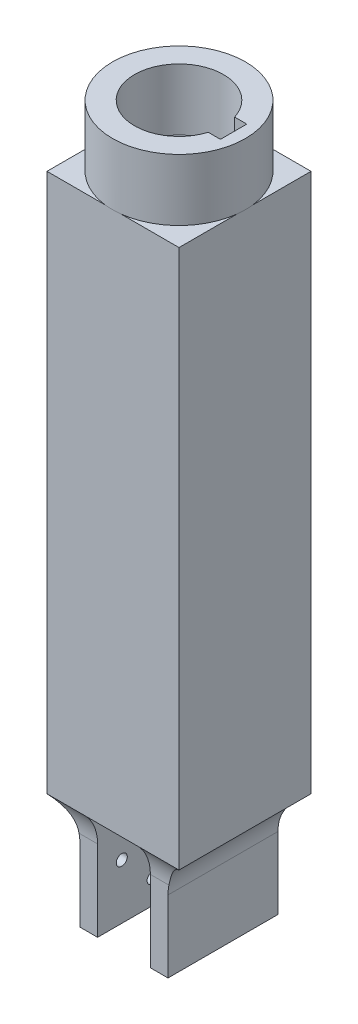
from build123d import *

# Parameters (mm, degrees)
SKETCH1_W           = 30
SKETCH1_H           = 30
BOSS_EXTRUDE1_DEPTH = 122.5
SKETCH2_W           = 4
SKETCH2_H           = 25
BOSS_EXTRUDE2_DEPTH = 25
SKETCH3_W           = 24
SKETCH3_H           = 24
CUT_EXTRUDE1_DEPTH  = 110
SKETCH5_W           = 24
SKETCH5_H           = 24
BOSS_EXTRUDE4_DEPTH = 4
SKETCH4_R           = 15.1
BOSS_EXTRUDE3_DEPTH = 14
SKETCH7_W           = 2.767549144
SKETCH7_H           = 5.993795478
CUT_EXTRUDE3_DEPTH  = 4
SKETCH12_R          = 2.1
CUT_EXTRUDE6_DEPTH  = 150.037813994
SKETCH13_W          = 9
SKETCH13_H          = 22
CUT_EXTRUDE7_DEPTH  = 20
SKETCH8_R           = 1.25
SKETCH8_R_2         = 1.5
CUT_EXTRUDE4_DEPTH  = 4
FILLET1_R           = 10


with BuildPart() as part:
    # Sketch1 → Boss-Extrude1 (new body)
    with BuildSketch(Plane(origin=(0, 0, 0), x_dir=(1, 0, 0), z_dir=(0, 1, 0))):
        Rectangle(SKETCH1_W, SKETCH1_H)
    extrude(amount=BOSS_EXTRUDE1_DEPTH)

    # Sketch2 → Boss-Extrude2 (add)
    with BuildSketch(Plane.XZ):
        with Locations((-8, 0)):
            Rectangle(SKETCH2_W, SKETCH2_H)
        with Locations((8, 0)):
            Rectangle(SKETCH2_W, SKETCH2_H)
    extrude(amount=BOSS_EXTRUDE2_DEPTH)

    # Sketch3 → Cut-Extrude1 (cut)
    with BuildSketch(Plane(origin=(0, 122.5, 0), x_dir=(1, 0, 0), z_dir=(0, 1, 0))):
        Rectangle(SKETCH3_W, SKETCH3_H)
    extrude(amount=-CUT_EXTRUDE1_DEPTH, mode=Mode.SUBTRACT)

    # Sketch5 → Boss-Extrude4 (add)
    with BuildSketch(Plane(origin=(0, 122.5, 0), x_dir=(1, 0, 0), z_dir=(0, 1, 0))):
        Rectangle(SKETCH5_W, SKETCH5_H)
    extrude(amount=-BOSS_EXTRUDE4_DEPTH)

    # Sketch4 → Boss-Extrude3 (add)
    with BuildSketch(Plane(origin=(0, 122.5, 0), x_dir=(1, 0, 0), z_dir=(0, 1, 0))):
        with Locations(Location((0, 0, 0), (0, 0, 83.402352246))):
            Circle(SKETCH4_R)
        with BuildLine():
            Line((12.412682836, -2.996897739), (12.412682836, 2.996897739))
            Line((12.412682836, 2.996897739), (9.645133692, 2.996897739))
            ThreePointArc((9.645133692, 2.996897739), (-10.1, 0), (9.645133692, -2.996897739))
            Line((9.645133692, -2.996897739), (12.412682836, -2.996897739))
        make_face(mode=Mode.SUBTRACT)
    extrude(amount=BOSS_EXTRUDE3_DEPTH)

    # Sketch7 → Cut-Extrude3 (cut)
    with BuildSketch(Plane(origin=(0, 122.5, 0), x_dir=(1, 0, 0), z_dir=(0, 1, 0))):
        with Locations((11.028908264, 0)):
            Rectangle(SKETCH7_W, SKETCH7_H)
    extrude(amount=-CUT_EXTRUDE3_DEPTH, mode=Mode.SUBTRACT)

    # Sketch12 → Cut-Extrude6 (cut, through all)
    with BuildSketch(Plane(origin=(0, 122.5, 0), x_dir=(1, 0, 0), z_dir=(0, 1, 0))):
        with Locations(Location((0, 0, 0), (0, 0, 270))):
            Circle(SKETCH12_R)
    extrude(amount=-CUT_EXTRUDE6_DEPTH, mode=Mode.SUBTRACT)

    # Sketch13 → Cut-Extrude7 (cut)
    with BuildSketch(Plane.XZ):
        Rectangle(SKETCH13_W, SKETCH13_H)
    extrude(amount=-CUT_EXTRUDE7_DEPTH, mode=Mode.SUBTRACT)

    # Sketch8 → Cut-Extrude4 (cut)
    with BuildSketch(Plane.ZY.offset(10)):
        with Locations((0, -5.5)):
            Circle(SKETCH8_R)
        with Locations((7, -12.5)):
            Circle(SKETCH8_R)
        with Locations((0, -19.5)):
            Circle(SKETCH8_R)
        with Locations((-7, -12.5)):
            Circle(SKETCH8_R)
        with Locations((0, -12.5)):
            Circle(SKETCH8_R_2)
    extrude(amount=-CUT_EXTRUDE4_DEPTH, mode=Mode.SUBTRACT)

    # Fillet1
    # the kernel refuses this fillet: 10 mm, written as the material it adds along each edge
    with BuildSketch(Plane(origin=(-10.535945694, 0, -12.5), x_dir=(0, 0, -1), z_dir=(1, 0, 0))) as fillet1_piece_1_section:
        with BuildLine():
            CenterArc((10, -6.614378278), FILLET1_R, 138.590377891, 41.409622109)
            Line((0, -6.614378278), (-0.2, -6.614378278))
            Line((-0.2, -6.614378278), (-0.2, 0))
            Line((-0.2, 0), (0, 0.2))
            ThreePointArc((0, 0.2), (1.25, 0.2), (2.35, 0.132287566))
            Line((2.35, 0.132287566), (2.5, 0))
        make_face()
    fillet1_piece_1 = extrude(amount=20.535945694, mode=Mode.PRIVATE)
    fillet1_piece_1 = split(fillet1_piece_1, bisect_by=Plane(origin=(-10, -1.814075663, -13.097749904), z_dir=(1, 0, 0)), keep=Keep.TOP, mode=Mode.PRIVATE)
    fillet1_piece_1 = split(fillet1_piece_1, bisect_by=Plane(origin=(-6, -1.814075663, -13.097749904), z_dir=(-1, 0, 0)), keep=Keep.TOP, mode=Mode.PRIVATE)
    add(fillet1_piece_1)
    with BuildSketch(Plane(origin=(6, 0, -12.5), x_dir=(0, 0, -1), z_dir=(1, 0, 0)), Plane(origin=(10, 0, 12.5), x_dir=(0, 0, 1), z_dir=(-1, 0, 0))) as fillet1_piece_2:
        with BuildLine():
            CenterArc((10, -6.614378278), FILLET1_R, 138.590377891, 41.409622109)
            Line((0, -6.614378278), (-0.2, -6.614378278))
            Line((-0.2, -6.614378278), (-0.2, 0))
            Line((-0.2, 0), (0, 0.2))
            ThreePointArc((0, 0.2), (1.25, 0.2), (2.35, 0.132287566))
            Line((2.35, 0.132287566), (2.5, 0))
        make_face()
    extrude(amount=4)
    with BuildSketch(Plane(origin=(10, 0, -12.5), x_dir=(1, 0, 0), z_dir=(0, 0, 1))) as fillet1_piece_3:
        with BuildLine():
            CenterArc((10, -8.660254038), FILLET1_R, 120, 60)
            Line((0, -8.660254038), (-0.2, -8.660254038))
            Line((-0.2, -8.660254038), (-0.2, 0))
            Line((-0.2, 0), (0, 0.2))
            ThreePointArc((0, 0.2), (2.5, 0.2), (4.9, 0.173205081))
            Line((4.9, 0.173205081), (5, 0))
        make_face()
    extrude(amount=25)
    with BuildSketch(Plane(origin=(10, 0, 12.5), x_dir=(0, 0, 1), z_dir=(-1, 0, 0))) as fillet1_piece_4_section:
        with BuildLine():
            CenterArc((10, -6.614378278), FILLET1_R, 138.590377891, 41.409622109)
            Line((0, -6.614378278), (-0.2, -6.614378278))
            Line((-0.2, -6.614378278), (-0.2, 0))
            Line((-0.2, 0), (0, 0.2))
            ThreePointArc((0, 0.2), (1.25, 0.2), (2.35, 0.132287566))
            Line((2.35, 0.132287566), (2.5, 0))
        make_face()
    fillet1_piece_4 = extrude(amount=20.535945694, mode=Mode.PRIVATE)
    fillet1_piece_4 = split(fillet1_piece_4, bisect_by=Plane(origin=(-10, -1.814075663, 13.097749904), z_dir=(1, 0, 0)), keep=Keep.TOP, mode=Mode.PRIVATE)
    fillet1_piece_4 = split(fillet1_piece_4, bisect_by=Plane(origin=(-6, -1.814075663, 13.097749904), z_dir=(-1, 0, 0)), keep=Keep.TOP, mode=Mode.PRIVATE)
    add(fillet1_piece_4)
    with BuildSketch(Plane(origin=(-10, 0, 12.5), x_dir=(0, 0, 1), z_dir=(1, 0, 0)), Plane(origin=(-6, 0, -12.5), x_dir=(0, 0, -1), z_dir=(-1, 0, 0))) as fillet1_piece_5:
        with BuildLine():
            CenterArc((10, 6.614378278), FILLET1_R, 180, 41.409622109)
            Line((0, 6.614378278), (-0.2, 6.614378278))
            Line((-0.2, 6.614378278), (-0.2, 0))
            Line((-0.2, 0), (0, -0.2))
            ThreePointArc((0, -0.2), (1.25, -0.2), (2.35, -0.132287566))
            Line((2.35, -0.132287566), (2.5, 0))
        make_face()
    extrude(amount=4)
    with BuildSketch(Plane(origin=(-10, 0, 12.5), x_dir=(0, 0, 1), z_dir=(1, 0, 0))) as fillet1_piece_6_section:
        with BuildLine():
            CenterArc((10, 6.614378278), FILLET1_R, 180, 41.409622109)
            Line((0, 6.614378278), (-0.2, 6.614378278))
            Line((-0.2, 6.614378278), (-0.2, 0))
            Line((-0.2, 0), (0, -0.2))
            ThreePointArc((0, -0.2), (1.25, -0.2), (2.35, -0.132287566))
            Line((2.35, -0.132287566), (2.5, 0))
        make_face()
    fillet1_piece_6 = extrude(amount=20.535945694, mode=Mode.PRIVATE)
    fillet1_piece_6 = split(fillet1_piece_6, bisect_by=Plane(origin=(6, -1.814075663, 13.097749904), z_dir=(1, 0, 0)), keep=Keep.TOP, mode=Mode.PRIVATE)
    fillet1_piece_6 = split(fillet1_piece_6, bisect_by=Plane(origin=(10, -1.814075663, 13.097749904), z_dir=(-1, 0, 0)), keep=Keep.TOP, mode=Mode.PRIVATE)
    add(fillet1_piece_6)
    with BuildSketch(Plane(origin=(-10, 0, -12.5), x_dir=(-1, 0, 0), z_dir=(0, 0, 1))) as fillet1_piece_7_section:
        with BuildLine():
            CenterArc((10, 8.660254038), FILLET1_R, 180, 60)
            Line((0, 8.660254038), (-0.2, 8.660254038))
            Line((-0.2, 8.660254038), (-0.2, 0))
            Line((-0.2, 0), (0, -0.2))
            ThreePointArc((0, -0.2), (2.5, -0.2), (4.9, -0.173205081))
            Line((4.9, -0.173205081), (5, 0))
        make_face()
    fillet1_piece_7 = extrude(amount=25, mode=Mode.PRIVATE)
    fillet1_piece_7 = fillet1_piece_7 - Plane(origin=(-11.30561436, -5.5, 0), x_dir=(0, 0, 1), z_dir=(-1, 0, 0)) * Cylinder(1.25, 85, mode=Mode.PRIVATE)
    add(fillet1_piece_7)
    with BuildSketch(Plane(origin=(10.535945694, 0, -12.5), x_dir=(0, 0, -1), z_dir=(-1, 0, 0))) as fillet1_piece_8_section:
        with BuildLine():
            CenterArc((10, 6.614378278), FILLET1_R, 180, 41.409622109)
            Line((0, 6.614378278), (-0.2, 6.614378278))
            Line((-0.2, 6.614378278), (-0.2, 0))
            Line((-0.2, 0), (0, -0.2))
            ThreePointArc((0, -0.2), (1.25, -0.2), (2.35, -0.132287566))
            Line((2.35, -0.132287566), (2.5, 0))
        make_face()
    fillet1_piece_8 = extrude(amount=20.535945694, mode=Mode.PRIVATE)
    fillet1_piece_8 = split(fillet1_piece_8, bisect_by=Plane(origin=(6, -1.814075663, -13.097749904), z_dir=(1, 0, 0)), keep=Keep.TOP, mode=Mode.PRIVATE)
    fillet1_piece_8 = split(fillet1_piece_8, bisect_by=Plane(origin=(10, -1.814075663, -13.097749904), z_dir=(-1, 0, 0)), keep=Keep.TOP, mode=Mode.PRIVATE)
    add(fillet1_piece_8)
    with BuildSketch(Plane(origin=(6, 0, -12.5), x_dir=(0, 0, -1), z_dir=(1, 0, 0))) as fillet1_piece_9a_section:
        with BuildLine():
            CenterArc((10, -6.614378278), FILLET1_R, 138.590377891, 41.409622109)
            Line((0, -6.614378278), (-0.2, -6.614378278))
            Line((-0.2, -6.614378278), (-0.2, 0))
            Line((-0.2, 0), (0, 0.2))
            ThreePointArc((0, 0.2), (1.25, 0.2), (2.35, 0.132287566))
            Line((2.35, 0.132287566), (2.5, 0))
        make_face()
    fillet1_piece_9a = extrude(amount=20.535945694, mode=Mode.PRIVATE)
    fillet1_piece_9a = split(fillet1_piece_9a, bisect_by=Plane(origin=(15, -1.814075663, -13.097749904), z_dir=(-1, 0, 0)), keep=Keep.TOP, mode=Mode.PRIVATE)
    fillet1_piece_9a = split(fillet1_piece_9a, bisect_by=Plane(origin=(10, -1.814075663, -13.097749904), z_dir=(1, 0, 0)), keep=Keep.TOP, mode=Mode.PRIVATE)
    with BuildSketch(Plane(origin=(10, 0, -34.150635095), x_dir=(1, 0, 0), z_dir=(0, 0, 1))) as fillet1_piece_9b_section:
        with BuildLine():
            CenterArc((10, -8.660254038), FILLET1_R, 120, 60)
            Line((0, -8.660254038), (-0.2, -8.660254038))
            Line((-0.2, -8.660254038), (-0.2, 0))
            Line((-0.2, 0), (0, 0.2))
            ThreePointArc((0, 0.2), (2.5, 0.2), (4.9, 0.173205081))
            Line((4.9, 0.173205081), (5, 0))
        make_face()
    fillet1_piece_9b = extrude(amount=46.650635095, mode=Mode.PRIVATE)
    fillet1_piece_9b = split(fillet1_piece_9b, bisect_by=Plane(origin=(11.295167111, -2.163104458, -15), z_dir=(0, 0, 1)), keep=Keep.TOP, mode=Mode.PRIVATE)
    fillet1_piece_9b = split(fillet1_piece_9b, bisect_by=Plane(origin=(11.295167111, -2.163104458, -12.5), z_dir=(0, 0, -1)), keep=Keep.TOP, mode=Mode.PRIVATE)
    fillet1_piece_9 = fillet1_piece_9a & fillet1_piece_9b
    add(fillet1_piece_9)
    with BuildSketch(Plane(origin=(26.535945694, 0, 12.5), x_dir=(0, 0, 1), z_dir=(-1, 0, 0))) as fillet1_piece_10a_section:
        with BuildLine():
            CenterArc((10, -6.614378278), FILLET1_R, 138.590377891, 41.409622109)
            Line((0, -6.614378278), (-0.2, -6.614378278))
            Line((-0.2, -6.614378278), (-0.2, 0))
            Line((-0.2, 0), (0, 0.2))
            ThreePointArc((0, 0.2), (1.25, 0.2), (2.35, 0.132287566))
            Line((2.35, 0.132287566), (2.5, 0))
        make_face()
    fillet1_piece_10a = extrude(amount=20.535945694, mode=Mode.PRIVATE)
    fillet1_piece_10a = split(fillet1_piece_10a, bisect_by=Plane(origin=(15, -1.814075663, 13.097749904), z_dir=(-1, 0, 0)), keep=Keep.TOP, mode=Mode.PRIVATE)
    fillet1_piece_10a = split(fillet1_piece_10a, bisect_by=Plane(origin=(10, -1.814075663, 13.097749904), z_dir=(1, 0, 0)), keep=Keep.TOP, mode=Mode.PRIVATE)
    with BuildSketch(Plane(origin=(10, 0, -12.5), x_dir=(1, 0, 0), z_dir=(0, 0, 1))) as fillet1_piece_10b_section:
        with BuildLine():
            CenterArc((10, -8.660254038), FILLET1_R, 120, 60)
            Line((0, -8.660254038), (-0.2, -8.660254038))
            Line((-0.2, -8.660254038), (-0.2, 0))
            Line((-0.2, 0), (0, 0.2))
            ThreePointArc((0, 0.2), (2.5, 0.2), (4.9, 0.173205081))
            Line((4.9, 0.173205081), (5, 0))
        make_face()
    fillet1_piece_10b = extrude(amount=46.650635095, mode=Mode.PRIVATE)
    fillet1_piece_10b = split(fillet1_piece_10b, bisect_by=Plane(origin=(11.295167111, -2.163104458, 15), z_dir=(0, 0, -1)), keep=Keep.TOP, mode=Mode.PRIVATE)
    fillet1_piece_10b = split(fillet1_piece_10b, bisect_by=Plane(origin=(11.295167111, -2.163104458, 12.5), z_dir=(0, 0, 1)), keep=Keep.TOP, mode=Mode.PRIVATE)
    fillet1_piece_10 = fillet1_piece_10a & fillet1_piece_10b
    add(fillet1_piece_10)
    with BuildSketch(Plane(origin=(-10, 0, -12.5), x_dir=(-1, 0, 0), z_dir=(0, 0, 1))) as fillet1_piece_11a_section:
        with BuildLine():
            CenterArc((10, 8.660254038), FILLET1_R, 180, 60)
            Line((0, 8.660254038), (-0.2, 8.660254038))
            Line((-0.2, 8.660254038), (-0.2, 0))
            Line((-0.2, 0), (0, -0.2))
            ThreePointArc((0, -0.2), (2.5, -0.2), (4.9, -0.173205081))
            Line((4.9, -0.173205081), (5, 0))
        make_face()
    fillet1_piece_11a = extrude(amount=46.650635095, mode=Mode.PRIVATE)
    fillet1_piece_11a = split(fillet1_piece_11a, bisect_by=Plane(origin=(-11.295167111, -2.163104458, 15), z_dir=(0, 0, -1)), keep=Keep.TOP, mode=Mode.PRIVATE)
    fillet1_piece_11a = split(fillet1_piece_11a, bisect_by=Plane(origin=(-11.295167111, -2.163104458, 12.5), z_dir=(0, 0, 1)), keep=Keep.TOP, mode=Mode.PRIVATE)
    with BuildSketch(Plane(origin=(-26.535945694, 0, 12.5), x_dir=(0, 0, 1), z_dir=(1, 0, 0))) as fillet1_piece_11b_section:
        with BuildLine():
            CenterArc((10, 6.614378278), FILLET1_R, 180, 41.409622109)
            Line((0, 6.614378278), (-0.2, 6.614378278))
            Line((-0.2, 6.614378278), (-0.2, 0))
            Line((-0.2, 0), (0, -0.2))
            ThreePointArc((0, -0.2), (1.25, -0.2), (2.35, -0.132287566))
            Line((2.35, -0.132287566), (2.5, 0))
        make_face()
    fillet1_piece_11b = extrude(amount=20.535945694, mode=Mode.PRIVATE)
    fillet1_piece_11b = split(fillet1_piece_11b, bisect_by=Plane(origin=(-15, -1.814075663, 13.097749904), z_dir=(1, 0, 0)), keep=Keep.TOP, mode=Mode.PRIVATE)
    fillet1_piece_11b = split(fillet1_piece_11b, bisect_by=Plane(origin=(-10, -1.814075663, 13.097749904), z_dir=(-1, 0, 0)), keep=Keep.TOP, mode=Mode.PRIVATE)
    fillet1_piece_11 = fillet1_piece_11a & fillet1_piece_11b
    add(fillet1_piece_11)
    with BuildSketch(Plane(origin=(-10, 0, -34.150635095), x_dir=(-1, 0, 0), z_dir=(0, 0, 1))) as fillet1_piece_12a_section:
        with BuildLine():
            CenterArc((10, 8.660254038), FILLET1_R, 180, 60)
            Line((0, 8.660254038), (-0.2, 8.660254038))
            Line((-0.2, 8.660254038), (-0.2, 0))
            Line((-0.2, 0), (0, -0.2))
            ThreePointArc((0, -0.2), (2.5, -0.2), (4.9, -0.173205081))
            Line((4.9, -0.173205081), (5, 0))
        make_face()
    fillet1_piece_12a = extrude(amount=46.650635095, mode=Mode.PRIVATE)
    fillet1_piece_12a = split(fillet1_piece_12a, bisect_by=Plane(origin=(-11.295167111, -2.163104458, -15), z_dir=(0, 0, 1)), keep=Keep.TOP, mode=Mode.PRIVATE)
    fillet1_piece_12a = split(fillet1_piece_12a, bisect_by=Plane(origin=(-11.295167111, -2.163104458, -12.5), z_dir=(0, 0, -1)), keep=Keep.TOP, mode=Mode.PRIVATE)
    with BuildSketch(Plane(origin=(-6, 0, -12.5), x_dir=(0, 0, -1), z_dir=(-1, 0, 0))) as fillet1_piece_12b_section:
        with BuildLine():
            CenterArc((10, 6.614378278), FILLET1_R, 180, 41.409622109)
            Line((0, 6.614378278), (-0.2, 6.614378278))
            Line((-0.2, 6.614378278), (-0.2, 0))
            Line((-0.2, 0), (0, -0.2))
            ThreePointArc((0, -0.2), (1.25, -0.2), (2.35, -0.132287566))
            Line((2.35, -0.132287566), (2.5, 0))
        make_face()
    fillet1_piece_12b = extrude(amount=20.535945694, mode=Mode.PRIVATE)
    fillet1_piece_12b = split(fillet1_piece_12b, bisect_by=Plane(origin=(-15, -1.814075663, -13.097749904), z_dir=(1, 0, 0)), keep=Keep.TOP, mode=Mode.PRIVATE)
    fillet1_piece_12b = split(fillet1_piece_12b, bisect_by=Plane(origin=(-10, -1.814075663, -13.097749904), z_dir=(-1, 0, 0)), keep=Keep.TOP, mode=Mode.PRIVATE)
    fillet1_piece_12 = fillet1_piece_12a & fillet1_piece_12b
    add(fillet1_piece_12)


solid = part.part
